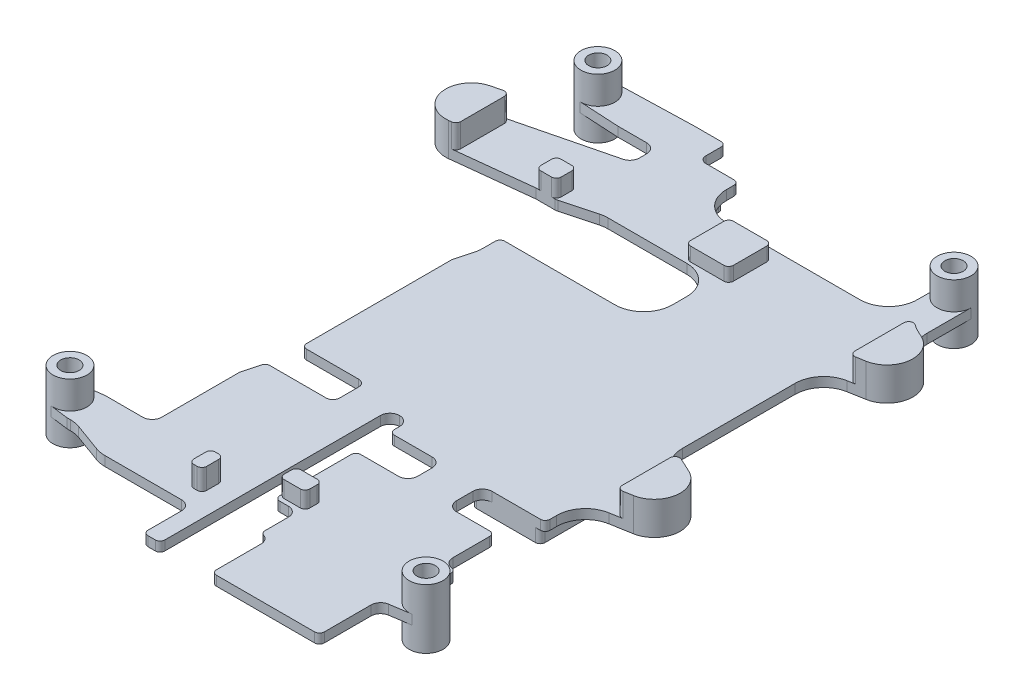
from build123d import *

# Parameters (mm, degrees)
BOSS_EXTRUDE2_DEPTH        = 1.27
BOSS_EXTRUDE2_DEPTH_BACK   = 6.6293999999999995
SKETCH3_R                  = 2.2479000000000005
SKETCH3_R_2                = 1.2191999999999987
BOSS_EXTRUDE2_2_DEPTH      = 1.27
BOSS_EXTRUDE2_2_DEPTH_BACK = 6.6293999999999995
BOSS_EXTRUDE2_3_DEPTH      = 1.27
BOSS_EXTRUDE2_3_DEPTH_BACK = 6.6293999999999995
BOSS_EXTRUDE2_4_DEPTH      = 1.27
BOSS_EXTRUDE2_4_DEPTH_BACK = 6.6293999999999995
BOSS_EXTRUDE3_START        = -3.683
BOSS_EXTRUDE3_DEPTH        = 1.27
BOSS_EXTRUDE4_DEPTH        = 1.27
BOSS_EXTRUDE5_DEPTH        = 1.27
BOSS_EXTRUDE6_DEPTH        = 1.27
BOSS_EXTRUDE7_DEPTH        = 1.27
BOSS_EXTRUDE12_DEPTH       = 1.27
CUT_EXTRUDE6_DEPTH         = 53.69431867668469
CUT_EXTRUDE6_DEPTH_BACK    = 53.69431867668469
SKETCH27_W                 = 6.350000000000001
SKETCH27_H                 = 4.445
CUT_EXTRUDE7_REACH         = 54.694
CUT_EXTRUDE8_REACH         = 54.694
SKETCH29_W                 = 19.05
SKETCH29_H                 = 9.525
CUT_EXTRUDE9_REACH         = 54.694
SKETCH34_W                 = 9.093199999999996
SKETCH34_H                 = 7.6327
BOSS_EXTRUDE15_DEPTH       = 1.7399000000000002
BOSS_EXTRUDE16_DEPTH       = 0.762
SKETCH36_W                 = 8.001
SKETCH36_H                 = 8.001000000000001
BOSS_EXTRUDE17_DEPTH       = 1.524
BOSS_EXTRUDE18_DEPTH       = 2.7686
SKETCH38_W                 = 5.6895999999999995
SKETCH38_H                 = 5.689599999999999
BOSS_EXTRUDE19_DEPTH       = 1.8287999999999998
SKETCH39_W                 = 3.4036000000000017
SKETCH39_H                 = 2.235199999999992
BOSS_EXTRUDE20_DEPTH       = 2.1844
BOSS_EXTRUDE23_DEPTH       = 1.27
SKETCH41_W                 = 2.6796999999999986
SKETCH41_H                 = 2.6797000000000004
BOSS_EXTRUDE24_DEPTH       = 2.286
BOSS_EXTRUDE25_DEPTH       = 1.27
BOSS_EXTRUDE26_DEPTH       = 4.3942
FILLET_0_150_R             = 3.8099999999999996
FILLET_0_025_R             = 0.635
FILLET_0_025_2_R           = 0.635
FILLET_0_050_R             = 1.27
FILLET_0_035_R             = 0.889


# Read off the part's stored shape, not the designer's step: Boss-Extrude3
with BuildPart() as part:
    # Sketch3 → Boss-Extrude2 (new, two sides: drawn at the far end of the back side and taken through both)
    with BuildSketch(Plane(origin=(0, 0, 0), x_dir=(1, 0, 0), z_dir=(0, 1, 0)).offset(-BOSS_EXTRUDE2_DEPTH_BACK)):
        with Locations(Location((-23.6093, 35.0012, 0), (0, 0, 270))):
            Circle(SKETCH3_R)
        with Locations(Location((-23.6093, 35.0012, 0), (0, 0, 270))):
            Circle(SKETCH3_R_2, mode=Mode.SUBTRACT)
    extrude(amount=BOSS_EXTRUDE2_DEPTH + BOSS_EXTRUDE2_DEPTH_BACK)



with BuildPart() as body_2:
    # Sketch3 → Boss-Extrude2 2 (new, two sides: drawn at the far end of the back side and taken through both)
    with BuildSketch(Plane(origin=(0, 0, 0), x_dir=(1, 0, 0), z_dir=(0, 1, 0)).offset(-BOSS_EXTRUDE2_2_DEPTH_BACK)):
        with Locations(Location((23.6093, 35.0012, 0), (0, 0, 270))):
            Circle(SKETCH3_R)
        with Locations(Location((23.6093, 35.0012, 0), (0, 0, 270))):
            Circle(SKETCH3_R_2, mode=Mode.SUBTRACT)
    extrude(amount=BOSS_EXTRUDE2_2_DEPTH + BOSS_EXTRUDE2_2_DEPTH_BACK)


with BuildPart() as body_3:
    # Sketch3 → Boss-Extrude2 3 (new, two sides: drawn at the far end of the back side and taken through both)
    with BuildSketch(Plane(origin=(0, 0, 0), x_dir=(1, 0, 0), z_dir=(0, 1, 0)).offset(-BOSS_EXTRUDE2_3_DEPTH_BACK)):
        with Locations(Location((23.6093, -35.0012, 0), (0, 0, 270))):
            Circle(SKETCH3_R)
        with Locations(Location((23.6093, -35.0012, 0), (0, 0, 270))):
            Circle(SKETCH3_R_2, mode=Mode.SUBTRACT)
    extrude(amount=BOSS_EXTRUDE2_3_DEPTH + BOSS_EXTRUDE2_3_DEPTH_BACK)


with BuildPart() as body_4:
    # Sketch3 → Boss-Extrude2 4 (new, two sides: drawn at the far end of the back side and taken through both)
    with BuildSketch(Plane(origin=(0, 0, 0), x_dir=(1, 0, 0), z_dir=(0, 1, 0)).offset(-BOSS_EXTRUDE2_4_DEPTH_BACK)):
        with Locations(Location((-23.6093, -35.0012, 0), (0, 0, 270))):
            Circle(SKETCH3_R)
        with Locations(Location((-23.6093, -35.0012, 0), (0, 0, 270))):
            Circle(SKETCH3_R_2, mode=Mode.SUBTRACT)
    extrude(amount=BOSS_EXTRUDE2_4_DEPTH + BOSS_EXTRUDE2_4_DEPTH_BACK)


with BuildPart() as body_5:
    # Boss-Extrude3 outline → Boss-Extrude3 (new body)
    with BuildSketch(Plane(origin=(0, 0, 0), x_dir=(1, 0, 0), z_dir=(0, 1, 0)).offset(BOSS_EXTRUDE3_START)):
        Polygon((-13.335, 33.274), (-13.335, 6.096), (-14.097, 6.096), (-14.097, -20.828), (-15.24, -20.828), (-15.24, -32.4612), (-20.32, -32.4612), (-20.32, -37.5412), (-15.295413295, -39.37), (-3.175, -39.37), (-3.175, -45.72), (20.193, -45.72), (20.193, -37.5412), (21.844, -37.5412), (21.844, -19.939), (22.225, -19.939), (22.225, -3.937), (22.86, -3.937), (22.86, 28.575), (-3.937, 28.575), (-3.937, 33.274), align=None)
    extrude(amount=BOSS_EXTRUDE3_DEPTH)


with BuildPart() as part_1:
    add(part.part)

    add(body_5.part)  # Boss-Extrude4 merges body 5
    # Sketch11 → Boss-Extrude4 (add)
    with BuildSketch(Plane(origin=(0, -2.4129999999999994, 0), x_dir=(1, 0, 0), z_dir=(0, 1, 0))):
        with BuildLine():
            Line((-13.335000000000004, 37.541199999999996), (-3.937000000000003, 37.541199999999996))
            Line((-3.937000000000003, 37.541199999999996), (-3.9370000000000047, 33.273999999999994))
            Line((-3.9370000000000047, 33.273999999999994), (-13.335000000000004, 33.273999999999994))
            Line((-13.335000000000004, 33.273999999999994), (-13.335000000000004, 32.4612))
            Line((-13.335000000000004, 32.4612), (-18.415000000000003, 32.4612))
            Line((-18.415000000000003, 32.4612), (-23.73401691504597, 32.75676240873099))
            ThreePointArc((-23.73401691504597, 32.75676240873099), (-21.36160750533703, 34.970657252321615), (-23.672985090257608, 37.24819769009201))
            Line((-23.672985090257608, 37.24819769009201), (-13.335000000000004, 37.541199999999996))
        make_face()
    extrude(amount=-BOSS_EXTRUDE4_DEPTH)


    add(body_4.part)  # Boss-Extrude5 merges body 4
    # Sketch12 → Boss-Extrude5 (add)
    with BuildSketch(Plane(origin=(0, -2.4129999999999994, 0), x_dir=(1, 0, 0), z_dir=(0, 1, 0))):
        with BuildLine():
            Line((-21.462999999999997, -32.4612), (-23.893830635272316, -32.771380113194894))
            ThreePointArc((-23.893830635272316, -32.771380113194894), (-21.361400000000003, -35.0012), (-23.893830635272316, -37.2310198868051))
            Line((-23.893830635272316, -37.2310198868051), (-21.462999999999997, -37.541199999999996))
            Line((-21.462999999999997, -37.541199999999996), (-20.319999999999997, -37.541199999999996))
            Line((-20.319999999999997, -37.541199999999996), (-20.319999999999997, -32.4612))
            Line((-20.319999999999997, -32.4612), (-21.462999999999997, -32.4612))
        make_face()
    extrude(amount=-BOSS_EXTRUDE5_DEPTH)


    add(body_3.part)  # Boss-Extrude6 merges body 3
    # Sketch13 → Boss-Extrude6 (add)
    with BuildSketch(Plane(origin=(0, -2.4129999999999994, 0), x_dir=(1, 0, 0), z_dir=(0, 1, 0))):
        with BuildLine():
            Line((23.944987049451637, -32.77850600063111), (21.843999999999998, -32.4612))
            Line((21.843999999999998, -32.4612), (20.192999999999998, -32.4612))
            Line((20.192999999999998, -32.4612), (20.192999999999998, -37.79054575735662))
            Line((20.192999999999998, -37.79054575735662), (21.843999999999998, -37.541199999999996))
            Line((21.843999999999998, -37.541199999999996), (23.944987049451637, -37.22389399936888))
            ThreePointArc((23.944987049451637, -37.22389399936888), (21.361400000000003, -35.0012), (23.944987049451637, -32.77850600063111))
        make_face()
    extrude(amount=-BOSS_EXTRUDE6_DEPTH)


    add(body_2.part)  # Boss-Extrude7 merges body 2
    # Sketch15 → Boss-Extrude7 (add)
    with BuildSketch(Plane(origin=(0, -2.4129999999999994, 0), x_dir=(1, 0, 0), z_dir=(0, 1, 0))):
        with BuildLine():
            Line((25.857199999999995, 35.0012), (25.857199999999995, 24.45763033920524))
            Line((25.857199999999995, 24.45763033920524), (22.860000000000003, 21.2614878136546))
            Line((22.860000000000003, 21.2614878136546), (22.86, 24.457630339205238))
            Line((22.86, 24.457630339205238), (21.361400000000003, 28.575000000000003))
            Line((21.361400000000003, 28.575000000000003), (21.361400000000003, 35.0012))
            ThreePointArc((21.361400000000003, 35.0012), (23.6093, 32.753299999999996), (25.857199999999995, 35.0012))
        make_face()
    extrude(amount=-BOSS_EXTRUDE7_DEPTH)

    # Sketch22 → Boss-Extrude12 (add)
    with BuildSketch(Plane(origin=(0, -2.4129999999999994, 0), x_dir=(1, 0, 0), z_dir=(0, 1, 0))):
        Polygon((-15.239999999999997, -20.828), (-14.097, -16.56226592694867), (-14.096999999999996, -20.828), align=None)
        Polygon((-14.097, 6.095999999999998), (-13.335000000000004, 8.939822715367539), (-13.335, 6.095999999999997), align=None)
        Polygon((22.86, -3.9369999999999994), (22.224999999999998, -6.3068522628062995), (22.224999999999998, -3.9369999999999994), align=None)
        Polygon((22.224999999999998, -19.939), (21.843999999999998, -21.360911357683776), (21.843999999999998, -19.939), align=None)
    extrude(amount=-BOSS_EXTRUDE12_DEPTH)

    # Sketch27 → Cut-Extrude6 (cut, two sides: drawn at the far end of the back side and taken through both)
    with BuildSketch(Plane(origin=(0, -2.4129999999999994, 0), x_dir=(1, 0, 0), z_dir=(0, 1, 0)).offset(-CUT_EXTRUDE6_DEPTH_BACK)):
        Polygon((0.1904999999999974, -39.370000000000005), (4.635499999999997, -39.370000000000005), (4.635499999999996, -33.02), (0.19049999999999623, -33.02), align=None)
        with Locations((5.333999999999998, -20.066)):
            Rectangle(SKETCH27_W, SKETCH27_H)
        Polygon((-5.6515, -13.7795), (-16.4465, -13.779500000000004), (-16.4465, -18.097500000000004), (-5.651499999999999, -18.097500000000004), align=None)
        Polygon((26.542999999999996, -38.16349999999999), (20.192999999999994, -38.16349999999999), (20.192999999999994, -45.72), (21.843999999999998, -45.72), (21.843999999999998, -42.608499999999985), (26.542999999999996, -42.608499999999985), align=None)
        Polygon((26.733499999999996, -24.828499999999995), (20.383499999999994, -24.828499999999995), (20.192999999999994, -24.828499999999995), (20.192999999999994, -29.2735), (26.7335, -29.27349999999999), align=None)
    extrude(amount=CUT_EXTRUDE6_DEPTH + CUT_EXTRUDE6_DEPTH_BACK, mode=Mode.SUBTRACT)

    # Sketch28 → Cut-Extrude7 (cut, up to next)
    with BuildSketch(Plane(origin=(0, -2.4129999999999994, 0), x_dir=(1, 0, 0), z_dir=(0, 1, 0)), mode=Mode.PRIVATE) as cut_extrude7_sk1:
        Polygon((1.6002000000000052, -45.72), (-0.9397999999999941, -45.72), (-0.9398000000000022, -15.24), (1.6002000000000058, -15.24), (1.6002000000000056, -17.843500000000002), (2.1589999999999976, -17.8435), (2.1589999999999976, -22.2885), (1.6002000000000056, -22.288500000000003), align=None)
    cut_extrude7_tool1 = extrude(cut_extrude7_sk1.sketch, amount=-CUT_EXTRUDE7_REACH, mode=Mode.PRIVATE) & part_1.part
    add(cut_extrude7_tool1.solids().sort_by_distance((0.378365, -2.413, 30.15627))[0], mode=Mode.SUBTRACT)

    # Sketch29 → Cut-Extrude8 (cut, up to next)
    with BuildSketch(Plane(origin=(0, -2.4129999999999994, 0), x_dir=(1, 0, 0), z_dir=(0, 1, 0)), mode=Mode.PRIVATE) as cut_extrude8_sk1:
        with Locations((-3.8100000000000023, 16.51)):
            Rectangle(SKETCH29_W, SKETCH29_H)
    cut_extrude8_tool1 = extrude(cut_extrude8_sk1.sketch, amount=-CUT_EXTRUDE8_REACH, mode=Mode.PRIVATE) & part_1.part
    add(cut_extrude8_tool1.solids().sort_by_distance((-3.81, -2.413, -16.51))[0], mode=Mode.SUBTRACT)

    # Sketch33 → Cut-Extrude9 (cut, up to next)
    with BuildSketch(Plane(origin=(0, -2.4129999999999994, 0), x_dir=(1, 0, 0), z_dir=(0, 1, 0)), mode=Mode.PRIVATE) as cut_extrude9_sk1:
        Polygon((5.905500000000001, -44.373799999999996), (5.905500000000001, -45.72), (1.6002000000000052, -45.72), (1.600200000000005, -39.370000000000005), (2.4765, -39.370000000000005), (2.4764999999999997, -38.023799999999994), (5.905499999999999, -38.023799999999994), align=None)
    cut_extrude9_tool1 = extrude(cut_extrude9_sk1.sketch, amount=-CUT_EXTRUDE9_REACH, mode=Mode.PRIVATE) & part_1.part
    # Sketch33 → Cut-Extrude9 (cut, up to next)
    with BuildSketch(Plane(origin=(0, -2.4129999999999994, 0), x_dir=(1, 0, 0), z_dir=(0, 1, 0)), mode=Mode.PRIVATE) as cut_extrude9_sk2:
        Polygon((24.079200000000004, -17.818099999999998), (13.893800000000002, -17.818100000000005), (13.893800000000002, -22.517100000000003), (20.192999999999994, -22.517100000000003), (20.192999999999994, -24.828499999999995), (21.843999999999998, -24.828499999999995), (21.843999999999998, -22.5171), (24.079200000000004, -22.5171), align=None)
    cut_extrude9_tool2 = extrude(cut_extrude9_sk2.sketch, amount=-CUT_EXTRUDE9_REACH, mode=Mode.PRIVATE) & part_1.part
    # Sketch33 → Cut-Extrude9 (cut, up to next)
    with BuildSketch(Plane(origin=(0, -2.4129999999999994, 0), x_dir=(1, 0, 0), z_dir=(0, 1, 0)), mode=Mode.PRIVATE) as cut_extrude9_sk3:
        Polygon((-9.182100000000002, 33.9979), (9.1313, 33.9979), (9.1313, 44.538900000000005), (-9.1821, 44.538900000000005), align=None)
    cut_extrude9_tool3 = extrude(cut_extrude9_sk3.sketch, amount=-CUT_EXTRUDE9_REACH, mode=Mode.PRIVATE) & part_1.part
    add(cut_extrude9_tool1.solids().sort_by_distance((3.816144, -2.413, 41.989112))[0], mode=Mode.SUBTRACT)
    add(cut_extrude9_tool2.solids().sort_by_distance((19.136553, -2.413, 20.426442))[0], mode=Mode.SUBTRACT)
    add(cut_extrude9_tool3.solids().sort_by_distance((-0.0254, -2.413, -39.2684))[0], mode=Mode.SUBTRACT)

    # Sketch34 → Boss-Extrude15 (add)
    with BuildSketch(Plane.XZ.offset(3.683)):
        with Locations((17.018, 14.001749999999998)):
            Rectangle(SKETCH34_W, SKETCH34_H)
    extrude(amount=BOSS_EXTRUDE15_DEPTH)

    # Sketch35 → Boss-Extrude16 (add)
    with BuildSketch(Plane.XZ.offset(3.683)):
        Polygon((-14.090650000000002, 3.1877), (-14.09065, -6.083299999999998), (-4.781549999999997, -6.0832999999999995), (-4.781550000000003, 3.1877), align=None)
    extrude(amount=BOSS_EXTRUDE16_DEPTH)

    # Sketch36 → Boss-Extrude17 (add)
    with BuildSketch(Plane.XZ.offset(3.683)):
        with Locations((-8.63600000000001, -28.663900000000005)):
            Rectangle(SKETCH36_W, SKETCH36_H)
    extrude(amount=BOSS_EXTRUDE17_DEPTH)

    # Sketch37 → Boss-Extrude18 (add)
    with BuildSketch(Plane(origin=(0, -2.4129999999999994, 0), x_dir=(1, 0, 0), z_dir=(0, 1, 0))):
        Polygon((-5.5499, -34.417), (-3.848099999999999, -34.417), (-3.848099999999999, -37.26180000000001), (-5.549899999999999, -37.26180000000001), align=None)
    extrude(amount=BOSS_EXTRUDE18_DEPTH)

    # Sketch38 → Boss-Extrude19 (add)
    with BuildSketch(Plane(origin=(0, -2.4129999999999994, 0), x_dir=(1, 0, 0), z_dir=(0, 1, 0))):
        with Locations((4.203700000000004, 24.523699999999998)):
            Rectangle(SKETCH38_W, SKETCH38_H)
    extrude(amount=BOSS_EXTRUDE19_DEPTH)

    # Sketch39 → Boss-Extrude20 (add)
    with BuildSketch(Plane(origin=(0, -2.4129999999999994, 0), x_dir=(1, 0, 0), z_dir=(0, 1, 0))):
        with Locations((3.3020000000000063, -31.318200000000004)):
            Rectangle(SKETCH39_W, SKETCH39_H)
    extrude(amount=BOSS_EXTRUDE20_DEPTH)

    # Sketch40 → Boss-Extrude23 (add)
    with BuildSketch(Plane(origin=(0, -2.4129999999999994, 0), x_dir=(1, 0, 0), z_dir=(0, 1, 0))):
        Polygon((-16.732249999999997, 22.61235), (-13.335000000000004, 26.00959999999998), (-13.335000000000003, 21.2725), (-9.052161725478724, 21.2725), (-14.052549999999998, 19.93265), (-16.732249999999997, 19.93265), align=None)
    extrude(amount=-BOSS_EXTRUDE23_DEPTH)

    # Sketch41 → Boss-Extrude24 (add)
    with BuildSketch(Plane(origin=(0, -2.4129999999999994, 0), x_dir=(1, 0, 0), z_dir=(0, 1, 0))):
        with Locations((-15.392399999999999, 21.2725)):
            Rectangle(SKETCH41_W, SKETCH41_H)
    extrude(amount=BOSS_EXTRUDE24_DEPTH)

    # Sketch42 → Boss-Extrude25 (add)
    with BuildSketch(Plane.XZ.offset(3.683)):
        with BuildLine():
            Line((-16.732249999999997, -19.93265), (-27.165375118236643, -18.766424004654418))
            ThreePointArc((-27.165375118236643, -18.766424004654418), (-30.92152705398207, -21.569317090613776), (-28.37250613881404, -25.502176023980045))
            Line((-28.37250613881404, -25.502176023980045), (-13.335000000000004, -29.235399999999988))
            Line((-13.335000000000004, -29.235399999999988), (-13.335000000000004, -26.00959999999998))
            Line((-13.335000000000004, -26.00959999999998), (-16.732249999999997, -22.61235))
            Line((-16.732249999999997, -22.61235), (-16.732249999999997, -19.93265))
        make_face()
        with BuildLine():
            Line((28.141739601219907, 12.051005785078859), (22.224999999999998, 13.094286614600197))
            Line((22.224999999999998, 13.094286614600197), (22.224999999999998, 6.306852262806287))
            Line((22.224999999999998, 6.306852262806287), (22.86, 3.9369999999999994))
            Line((22.86, 3.9369999999999994), (22.86, 2.7053595374658688))
            Line((22.86, 2.7053595374658688), (28.995458019508842, 5.566370598251325))
            ThreePointArc((28.995458019508842, 5.566370598251325), (30.945964429650786, 9.121674313122547), (28.141739601219907, 12.051005785078859))
        make_face()
        with BuildLine():
            Line((28.995458019508842, -25.28192940174867), (25.857199999999995, -26.74532314951198))
            Line((25.857199999999995, -26.74532314951198), (25.857199999999995, -24.45763033920524))
            Line((25.857199999999995, -24.45763033920524), (22.86, -21.261487813654604))
            Line((22.86, -21.261487813654604), (22.860000000000003, -17.86598101814968))
            Line((22.860000000000003, -17.86598101814968), (28.14173960121991, -18.797294214921134))
            ThreePointArc((28.14173960121991, -18.797294214921134), (30.945964429650783, -21.726625686877455), (28.995458019508842, -25.28192940174867))
        make_face()
    extrude(amount=-BOSS_EXTRUDE25_DEPTH)

    # Sketch43 → Boss-Extrude26 (add)
    with BuildSketch(Plane.XZ.offset(3.683)):
        with BuildLine():
            Line((-26.238200000000003, -18.870064640884795), (-26.238200000000003, -26.032040668824376))
            Line((-26.238200000000003, -26.032040668824376), (-28.37250613881404, -25.502176023980045))
            ThreePointArc((-28.37250613881404, -25.502176023980045), (-30.921527053982075, -21.569317090613776), (-27.165375118236643, -18.766424004654414))
            Line((-27.165375118236643, -18.766424004654414), (-26.238200000000003, -18.870064640884795))
        make_face()
        with BuildLine():
            Line((26.238199999999992, -18.461648824379022), (26.238199999999992, -26.567659931754925))
            Line((26.238199999999992, -26.567659931754925), (28.995458019508842, -25.28192940174867))
            ThreePointArc((28.995458019508842, -25.28192940174867), (30.945964429650783, -21.726625686877455), (28.14173960121991, -18.797294214921134))
            Line((28.14173960121991, -18.797294214921134), (26.238199999999992, -18.461648824379022))
        make_face()
        with BuildLine():
            Line((26.23819999999999, 12.38665117562097), (26.23819999999999, 4.28064006824507))
            Line((26.23819999999999, 4.28064006824507), (28.995458019508842, 5.566370598251325))
            ThreePointArc((28.995458019508842, 5.566370598251325), (30.945964429650786, 9.121674313122547), (28.141739601219907, 12.051005785078859))
            Line((28.141739601219907, 12.051005785078859), (26.23819999999999, 12.38665117562097))
        make_face()
    extrude(amount=-BOSS_EXTRUDE26_DEPTH)

    # Fillet 0.150
    fillet_0_150_edges = [part_1.edges().sort_by_distance(p)[0] for p in [
        (21.361400000000003, -3.047999999999999, -28.575000000000003),
        (-13.335000000000004, -3.047999999999999, -8.939822715367539),
        (-3.937, -3.048, -28.575),
        (-15.295413295, -3.048, 39.37),
        (-20.32, -3.048, 37.5412),
        (5.714999999999998, -3.047999999999999, -11.7475),
        (5.714999999999998, -3.047999999999999, -21.2725),
        (-9.052161725478724, -3.047999999999999, -21.2725),
        (25.857199999999995, -3.048, -26.74532314951198),
        (22.860000000000003, -3.048, -17.86598101814968),
        (22.86, -3.048, 2.7053595374658688),
        (22.224999999999998, -3.048, 13.094286614600197),
    ]]
    fillet(fillet_0_150_edges, radius=FILLET_0_150_R)

    # Fillet 0.025
    fillet_0_025_edges = [part_1.edges().sort_by_distance(p)[0] for p in [
        (-14.508364730066837, -3.0479999999999996, 18.097500000000004),
        (21.844, -3.0479999999999996, 29.2735),
        (-14.097, -3.0479999999999996, 13.779500000000002),
        (20.193, -3.048, 45.72),
        (-3.175, -3.048, 45.72),
        (1.6002000000000056, -3.047999999999999, 22.288500000000003),
        (1.6002000000000056, -3.047999999999999, 17.843500000000002),
        (-0.9397999999999941, -3.0479999999999996, 45.72),
        (-13.335000000000003, -3.0479999999999996, -11.7475),
        (4.635499999999997, -3.048000000000001, 38.023799999999994),
        (-9.182100000000002, -3.047999999999999, -37.541199999999996),
        (22.225, -3.0479999999999996, 17.8181),
        (20.192999999999994, -3.047999999999999, 22.517100000000003),
        (5.905500000000001, -3.0479999999999996, 45.72),
        (-3.9370000000000047, -3.0479999999999996, -33.9979),
        (12.471400000000003, -4.55295, 10.185399999999998),
        (21.5646, -4.55295, 10.185399999999998),
        (21.5646, -4.55295, 17.818099999999998),
        (12.471400000000003, -4.55295, 17.818099999999998),
        (-4.781550000000003, -4.064, 3.1877),
        (-14.090650000000002, -4.064, 3.1877),
        (-14.09065, -4.064, -6.083299999999998),
        (-4.781549999999997, -4.064, -6.0832999999999995),
        (-4.635500000000009, -4.445, -24.663400000000006),
        (-12.636500000000009, -4.445, -24.663400000000006),
        (-12.636500000000009, -4.445, -32.66440000000001),
        (-4.635500000000009, -4.445, -32.66440000000001),
        (-3.848099999999999, -1.0286999999999993, 37.26180000000001),
        (-3.848099999999999, -1.0286999999999993, 34.417),
        (-5.5499, -1.0286999999999993, 34.417),
        (-5.549899999999999, -1.0286999999999993, 37.26180000000001),
        (7.048500000000004, -1.4985999999999995, -21.6789),
        (7.048500000000004, -1.4985999999999995, -27.368499999999997),
        (1.3589000000000044, -1.4985999999999995, -27.368499999999997),
        (1.3589000000000044, -1.4985999999999995, -21.6789),
        (5.003800000000007, -1.3207999999999993, 32.4358),
        (5.003800000000007, -1.3207999999999993, 30.200600000000005),
        (1.6002000000000054, -1.3207999999999993, 30.200600000000005),
        (1.6002000000000054, -1.3207999999999993, 32.4358),
        (-16.732249999999997, -1.2699999999999994, -22.61235),
        (-14.052549999999998, -1.2699999999999994, -19.93265),
        (-14.052549999999998, -1.2699999999999994, -22.61235),
        (-16.732249999999997, -1.2699999999999996, -19.93265),
        (-26.238200000000003, -0.8509000000000002, -26.032040668824376),
        (-26.238200000000003, -0.8509000000000002, -18.870064640884795),
        (26.238199999999992, -0.8509000000000002, -18.461648824379022),
        (26.23819999999999, -0.8509000000000002, 12.38665117562097),
        (26.23819999999999, -0.8509000000000002, 4.28064006824507),
        (26.238199999999992, -0.8508999999999998, -27.511820345699537),
    ]]
    fillet(fillet_0_025_edges, radius=FILLET_0_025_R)

    # Fillet 0.025-2
    fillet_0_025_2_edges = [part_1.edges().sort_by_distance(p)[0] for p in [
        (1.6002000000000054, -3.048000000000001, 33.02),
    ]]
    fillet(fillet_0_025_2_edges, radius=FILLET_0_025_2_R)

    # Fillet 0.050
    # the kernel refuses this fillet: 1.27 mm, written as the material it adds along each edge
    with BuildSketch(Plane(origin=(20.192999999999998, -2.4129999999999994, 37.79054575735662), x_dir=(3.25e-15, 0, 1), z_dir=(0, -1, 0))) as fillet_0_050_piece_1:
        with BuildLine():
            CenterArc((FILLET_0_050_R * 0.860313183502, -FILLET_0_050_R), FILLET_0_050_R, 90.00000000000018, 81.4116890218326)
            Line((-FILLET_0_050_R * 0.12847368396, -FILLET_0_050_R * 0.850666377752), (0, 0))
            Line((0, 0), (FILLET_0_050_R * 0.860313183502, 0))
        make_face()
    extrude(amount=1.27)
    with BuildSketch(Plane(origin=(21.843999999999998, -2.4129999999999994, 32.4612), x_dir=(0.98878686746247, 0, 0.1493336222481597), z_dir=(0, -1, 0))) as fillet_0_050_piece_2:
        with BuildLine():
            CenterArc((FILLET_0_050_R * 0.860313183502, -FILLET_0_050_R), FILLET_0_050_R, 89.99999999999989, 81.41168902183259)
            Line((-FILLET_0_050_R * 0.12847368396, -FILLET_0_050_R * 0.850666377752), (0, 0))
            Line((0, 0), (FILLET_0_050_R * 0.860313183502, 1e-17))
        make_face()
    extrude(amount=1.27)
    with BuildSketch(Plane(origin=(20.192999999999994, -3.683, 29.2735), x_dir=(0.9999867328228743, 0, 0.005151133684301854), z_dir=(0, 1, 0))) as fillet_0_050_piece_3:
        with BuildLine():
            CenterArc((1.2635288279249441, 1.2595160470385485), FILLET_0_050_R, 180.2951395250421, 82.33774433923406)
            Line((-0.00645432276010566, 1.252974107259485), (-0.13345263782860958, 1.2523199132815788))
            Line((-0.13345263782860958, 1.2523199132815788), (-0.12699831506850393, -0.00065419397790633))
            Line((-0.12699831506850393, -0.00065419397790633), (0.00065419397790633, -0.12699831506850393))
            ThreePointArc((0.00065419397790633, -0.12699831506850393), (1.016640714525952, -0.12176476324525322), (1.0843965137675395, -0.1259516047038545))
            Line((1.0843965137675395, -0.1259516047038545), (1.1006812696000317, 0))
        make_face()
    extrude(amount=1.2700000000000031)
    with BuildSketch(Plane(origin=(8.508999999999999, -2.4129999999999967, 17.8435), x_dir=(0, 0, 1), z_dir=(0, -1, 0))) as fillet_0_050_piece_4:
        with BuildLine():
            CenterArc((FILLET_0_050_R, FILLET_0_050_R), FILLET_0_050_R, 179.99999999999957, 90.00000000000045)
            Line((7.11e-15, FILLET_0_050_R), (0, 0))
            Line((0, 0), (FILLET_0_050_R, 0))
        make_face()
    extrude(amount=1.2700000000000031)
    with BuildSketch(Plane(origin=(8.508999999999999, -2.4129999999999967, 22.2885), x_dir=(-1, 0, 0), z_dir=(0, -1, 0))) as fillet_0_050_piece_5:
        with BuildLine():
            CenterArc((FILLET_0_050_R, FILLET_0_050_R), FILLET_0_050_R, 180, 90)
            Line((0, FILLET_0_050_R), (0, 0))
            Line((0, 0), (FILLET_0_050_R, 0))
        make_face()
    extrude(amount=1.2700000000000031)
    with BuildSketch(Plane(origin=(4.635499999999996, -3.683, 33.02), x_dir=(-1, 0, 0), z_dir=(0, 1, 0))) as fillet_0_050_piece_6:
        with BuildLine():
            CenterArc((FILLET_0_050_R, FILLET_0_050_R), FILLET_0_050_R, 180, 90)
            Line((-8.9e-16, FILLET_0_050_R), (0, 0))
            Line((0, 0), (FILLET_0_050_R, 0))
        make_face()
    extrude(amount=1.2700000000000031)
    with BuildSketch(Plane(origin=(-3.175, -3.683, 39.37), x_dir=(-3.5e-16, 0, 1), z_dir=(0, 1, 0))) as fillet_0_050_piece_7:
        with BuildLine():
            CenterArc((FILLET_0_050_R, -FILLET_0_050_R), FILLET_0_050_R, 90.00000000000003, 90)
            Line((4.4e-16, -FILLET_0_050_R), (0, 0))
            Line((0, 0), (FILLET_0_050_R, 0))
        make_face()
    extrude(amount=1.27)
    with BuildSketch(Plane(origin=(-15.24, -3.683, 32.4612), x_dir=(-1, 0, 0), z_dir=(0, 1, 0))) as fillet_0_050_piece_8:
        with BuildLine():
            CenterArc((FILLET_0_050_R, -FILLET_0_050_R), FILLET_0_050_R, 90, 90)
            Line((1.78e-15, -FILLET_0_050_R), (0, 0))
            Line((0, 0), (FILLET_0_050_R, 0))
        make_face()
    extrude(amount=1.27)
    with BuildSketch(Plane(origin=(1.6002000000000058, -2.4129999999999994, 15.24), x_dir=(0, 0, 1), z_dir=(0, -1, 0))) as fillet_0_050_piece_9:
        with BuildLine():
            CenterArc((FILLET_0_050_R, FILLET_0_050_R), FILLET_0_050_R, 180, 90)
            Line((1.78e-15, FILLET_0_050_R), (0, 0))
            Line((0, 0), (FILLET_0_050_R, 0))
        make_face()
    extrude(amount=1.27)
    with BuildSketch(Plane(origin=(-0.9398000000000022, -2.4129999999999994, 15.24), x_dir=(1, 0, 1.4e-15), z_dir=(0, -1, 0))) as fillet_0_050_piece_10:
        with BuildLine():
            CenterArc((FILLET_0_050_R, FILLET_0_050_R), FILLET_0_050_R, 179.99999999999991, 90)
            Line((2e-15, FILLET_0_050_R), (0, 0))
            Line((0, 0), (FILLET_0_050_R, 0))
        make_face()
    extrude(amount=1.27)
    with BuildSketch(Plane(origin=(13.893800000000002, -2.4129999999999994, 17.818100000000005), x_dir=(0, 0, 1), z_dir=(0, -1, 0))) as fillet_0_050_piece_11:
        with BuildLine():
            CenterArc((FILLET_0_050_R, -FILLET_0_050_R), FILLET_0_050_R, 90, 89.99999999999991)
            Line((0, -FILLET_0_050_R), (0, 0))
            Line((0, 0), (FILLET_0_050_R, 0))
        make_face()
    extrude(amount=1.27)
    with BuildSketch(Plane(origin=(13.893800000000002, -2.4129999999999994, 22.517100000000003), x_dir=(1, 0, 0), z_dir=(0, -1, 0))) as fillet_0_050_piece_12:
        with BuildLine():
            CenterArc((FILLET_0_050_R, -FILLET_0_050_R), FILLET_0_050_R, 90, 90)
            Line((0, -FILLET_0_050_R), (0, 0))
            Line((0, 0), (FILLET_0_050_R, 0))
        make_face()
    extrude(amount=1.27)
    with BuildSketch(Plane(origin=(5.905499999999999, -2.4129999999999994, 38.023799999999994), x_dir=(-0.9990813533098188, 0, -0.042853815099952154), z_dir=(0, -1, 0))) as fillet_0_050_piece_13:
        with BuildLine():
            CenterArc((1.219077844219427, -1.2144089735265196), FILLET_0_050_R, 107.01512575268046, 70.52877936551124)
            Line((-0.04975547448404408, -1.1599846283496158), (-0.17663880635439116, -1.154542193831929))
            Line((-0.17663880635439116, -1.154542193831929), (-0.12688333187034678, 0.00544243451769391))
            Line((-0.12688333187034678, 0.00544243451769391), (0.00544243451769403, 0.12688333187034945))
            ThreePointArc((0.00544243451769403, 0.12688333187034945), (0.6398590938694314, 0.09967115928187971), (0.8102819018813311, 0.12144089735265125))
            Line((0.8102819018813311, 0.12144089735265125), (0.8474451693666126, -1e-17))
        make_face()
    extrude(amount=1.27)
    with BuildSketch(Plane(origin=(-13.335000000000004, -3.683, -29.235399999999988), x_dir=(-0.9705383563663001, 0, 0.2409466721534051), z_dir=(0, 1, 0))) as fillet_0_050_piece_14:
        with BuildLine():
            CenterArc((FILLET_0_050_R * 0.782095136032, -FILLET_0_050_R), FILLET_0_050_R, 90.0000000000001, 76.05757955649078)
            Line((-FILLET_0_050_R * 0.188443220334, -FILLET_0_050_R * 0.759053327847), (0, 0))
            Line((0, 0), (FILLET_0_050_R * 0.782095136032, 0))
        make_face()
    extrude(amount=1.27)
    with BuildSketch(Plane(origin=(-13.335000000000004, -2.4129999999999994, -32.4612), x_dir=(2.8e-15, 0, 1), z_dir=(0, -1, 0))) as fillet_0_050_piece_15:
        with BuildLine():
            CenterArc((FILLET_0_050_R, FILLET_0_050_R), FILLET_0_050_R, 180, 90.00000000000017)
            Line((-3.55e-15, FILLET_0_050_R), (0, 0))
            Line((0, 0), (FILLET_0_050_R, 0))
        make_face()
    extrude(amount=1.27)
    # the kernel refuses this fillet: 1.27 mm, written as the material it takes off along each edge
    with BuildSketch(Plane(origin=(-14.052549999999998, -1.995003320160028, -19.93265), x_dir=(-1, 0, 0), z_dir=(0, -1, 0))) as fillet_0_050_2_piece_1:
        with BuildLine():
            CenterArc((FILLET_0_050_R * 0.131652497587, FILLET_0_050_R), FILLET_0_050_R, 255.0000000000004, 14.999999999999602)
            Line((-FILLET_0_050_R * 0.127166547515, FILLET_0_050_R * 0.0340741737109), (0, 0))
            Line((0, 0), (FILLET_0_050_R * 0.131652497587, 0))
        make_face()
    extrude(amount=2.1059933596799434, mode=Mode.SUBTRACT)
    with BuildSketch(Plane(origin=(-13.335000000000003, -2.3680156253803917, -37.541199999999996), x_dir=(1, 0, 0), z_dir=(0, -1, 0))) as fillet_0_050_2_piece_2:
        with BuildLine():
            CenterArc((FILLET_0_050_R * 0.0141683069668, FILLET_0_050_R), FILLET_0_050_R, 268.3765402417011, 1.6234597582989068)
            Line((-FILLET_0_050_R * 0.0141626197904, FILLET_0_050_R * 0.000401401266955), (0, 0))
            Line((0, 0), (FILLET_0_050_R * 0.0141683069668, 0))
        make_face()
    extrude(amount=1.3599687492392154, mode=Mode.SUBTRACT)

    # Fillet 0.035
    fillet_0_035_edges = [part_1.edges().sort_by_distance(p)[0] for p in [
        (-5.6515, -3.048000000000002, 13.7795),
        (-5.651499999999999, -3.048000000000002, 18.097500000000004),
        (-9.182100000000002, -3.047999999999999, -33.9979),
    ]]
    fillet(fillet_0_035_edges, radius=FILLET_0_035_R)


solid = part_1.part
